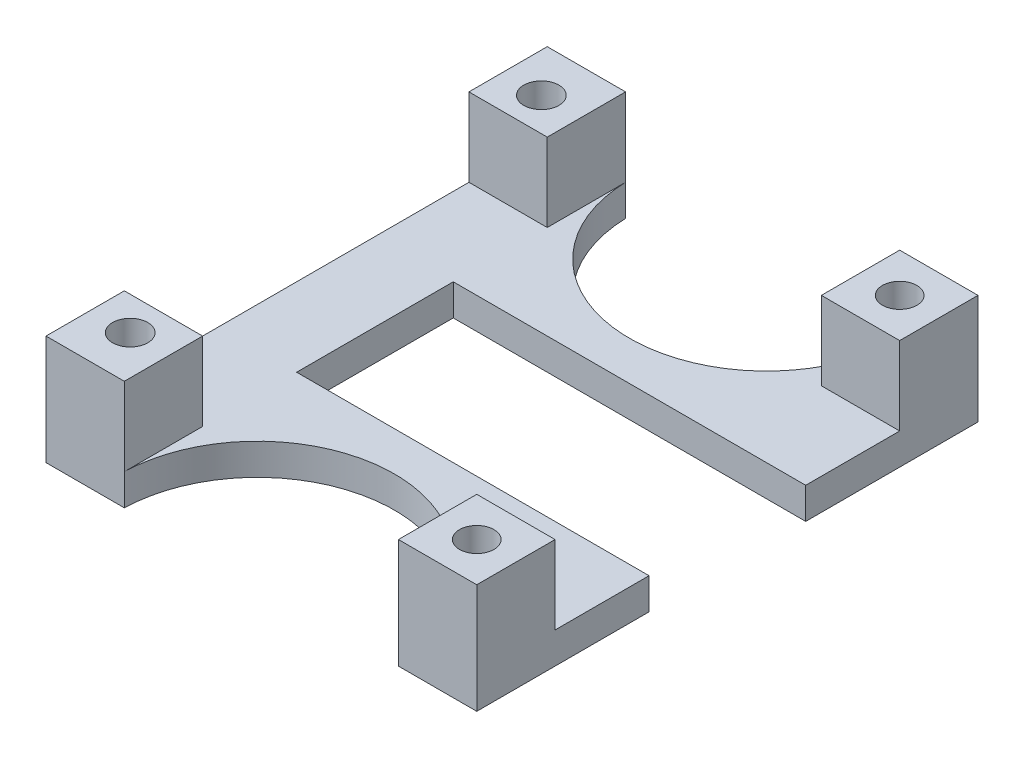
from build123d import *

# Parameters (mm, degrees)
SKETCH1_R          = 2.2479
SKETCH1_R_2        = 2.2
EXTRUDE_BODY_DEPTH = 4
SKETCH5_W          = 10
SKETCH5_H          = 10
SKETCH5_R          = 2.2
SKETCH5_R_2        = 2.2479
EXTRUDE_LEGS_DEPTH = 10


with BuildPart() as part:
    # Sketch1 → Extrude-Body (new body)
    with BuildSketch(Plane(origin=(0, 0, 0), x_dir=(1, 0, 0), z_dir=(0, 1, 0))):
        with BuildLine():
            Line((10, -10), (10, 10))
            Line((10, 10), (45, 10))
            Line((45, 10), (55, 10))
            Line((55, 10), (55, 20))
            Line((55, 20), (55, 32))
            Line((55, 32), (45, 32))
            ThreePointArc((45, 32), (27.5, 15), (10, 32))
            Line((10, 32), (0, 32))
            Line((0, 32), (0, 20))
            Line((0, 20), (0, -20))
            Line((0, -20), (0, -32))
            Line((0, -32), (10, -32))
            ThreePointArc((10, -32), (27.5, -15), (45, -32))
            Line((45, -32), (55, -32))
            Line((55, -32), (55, -20))
            Line((55, -20), (55, -10))
            Line((55, -10), (45, -10))
            Line((45, -10), (10, -10))
        make_face()
        with Locations((5, -26.25)):
            Circle(SKETCH1_R, mode=Mode.SUBTRACT)
        with Locations((50, -27)):
            Circle(SKETCH1_R_2, mode=Mode.SUBTRACT)
        with Locations((5, 26.25)):
            Circle(SKETCH1_R, mode=Mode.SUBTRACT)
        with Locations((50, 27)):
            Circle(SKETCH1_R_2, mode=Mode.SUBTRACT)
    extrude(amount=EXTRUDE_BODY_DEPTH)

    # Sketch5 → Extrude-Legs (add)
    # profile 1 of 4: a face of its own
    with BuildSketch(Plane(origin=(0, 4, 0), x_dir=(1, 0, 0), z_dir=(0, 1, 0))):
        with Locations((50, -27)):
            Rectangle(SKETCH5_W, SKETCH5_H)
        with Locations((50, -27)):
            Circle(SKETCH5_R, mode=Mode.SUBTRACT)
    # profile 2 of 4: a face of its own
    with BuildSketch(Plane(origin=(0, 4, 0), x_dir=(1, 0, 0), z_dir=(0, 1, 0))):
        with Locations((50, 27)):
            Rectangle(SKETCH5_W, SKETCH5_H)
        with Locations((50, 27)):
            Circle(SKETCH5_R, mode=Mode.SUBTRACT)
    # profile 3 of 4: a face of its own
    with BuildSketch(Plane(origin=(0, 4, 0), x_dir=(1, 0, 0), z_dir=(0, 1, 0))):
        with Locations((5, 27)):
            Rectangle(SKETCH5_W, SKETCH5_H)
        with Locations((5, 26.25)):
            Circle(SKETCH5_R_2, mode=Mode.SUBTRACT)
    # profile 4 of 4: a face of its own
    with BuildSketch(Plane(origin=(0, 4, 0), x_dir=(1, 0, 0), z_dir=(0, 1, 0))):
        with Locations((5, -27)):
            Rectangle(SKETCH5_W, SKETCH5_H)
        with Locations((5, -26.25)):
            Circle(SKETCH5_R_2, mode=Mode.SUBTRACT)
    extrude(amount=EXTRUDE_LEGS_DEPTH)


solid = part.part
